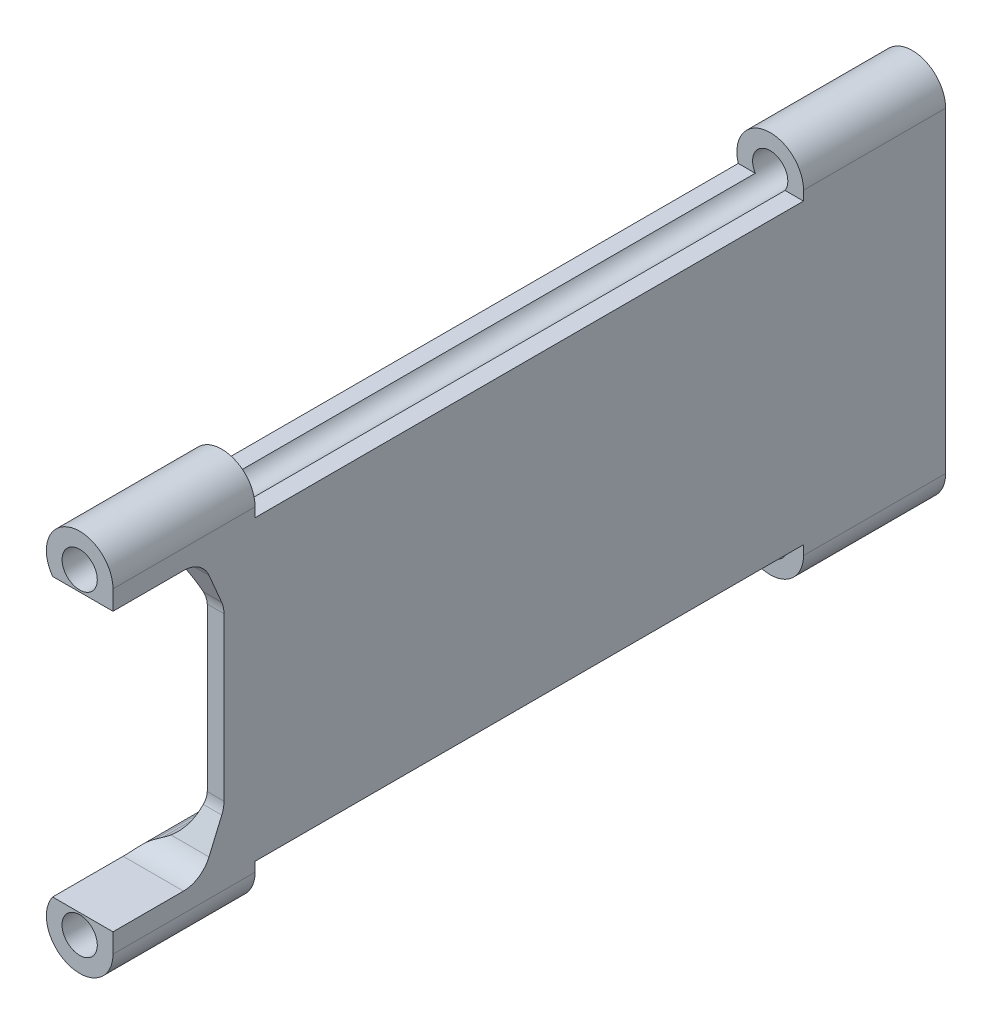
from build123d import *

# Parameters (mm, degrees)
CROQUIS1_R              = 3.175
SALIENTE_EXTRUIR1_DEPTH = 150
REDONDEO1_R             = 10
CORTAR_EXTRUIR1_DEPTH   = 155.383451186
REDONDEO2_R             = 5
CROQUIS3_W              = 98.791812306
CROQUIS3_H              = 18.145434914
CORTAR_EXTRUIR2_DEPTH   = 155.383451313


with BuildPart() as part:
    # Croquis1 → Saliente-Extruir1 (new body)
    with BuildSketch(Plane.XY):
        with BuildLine():
            Line((-3, 19.859827637), (-8.98691391, 23.296314259))
            ThreePointArc((-8.98691391, 23.296314259), (-9.006535925, 33.69237342), (0, 28.5))
            Line((0, 28.5), (0, -28.5))
            ThreePointArc((0, -28.5), (-9.006535925, -33.69237342), (-8.98691391, -23.296314259))
            Line((-8.98691391, -23.296314259), (-3, -19.859827637))
            Line((-3, -19.859827637), (-3, 19.859827637))
        make_face()
        with Locations((-6, 28.5)):
            Circle(CROQUIS1_R, mode=Mode.SUBTRACT)
        with Locations((-6, -28.5)):
            Circle(CROQUIS1_R, mode=Mode.SUBTRACT)
    extrude(amount=-SALIENTE_EXTRUIR1_DEPTH)

    # Redondeo1
    redondeo1_edges = [part.edges().sort_by_distance(p)[0] for p in [
        (-3, -19.859827637, -75),
        (-3, 19.859827637, -75),
    ]]
    fillet(redondeo1_edges, radius=REDONDEO1_R)

    # Croquis2 → Cortar-Extruir1 (cut, through all)
    with BuildSketch(Plane(origin=(0, 0, 0), x_dir=(0, 0, -1), z_dir=(1, 0, 0))):
        Polygon((16, 25), (20, 15.646846929), (20, -15.646846929), (16, -25), (-29.873538988, -25), (-29.873538988, 25), align=None)
    extrude(amount=-CORTAR_EXTRUIR1_DEPTH, mode=Mode.SUBTRACT)

    # Redondeo2
    redondeo2_edges = [part.edges().sort_by_distance(p)[0] for p in [
        (-1.562589533, 15.646846929, -20),
        (-1.562589533, -15.646846929, -20),
        (-5.436698586, -25, -16),
        (-5.436698586, 25, -16),
    ]]
    fillet(redondeo2_edges, radius=REDONDEO2_R)

    # Croquis3 → Cortar-Extruir2 (cut, through all)
    with BuildSketch(Plane(origin=(0, 0, 0), x_dir=(0, 0, -1), z_dir=(1, 0, 0))):
        with Locations((75, 35.875128035)):
            Rectangle(CROQUIS3_W, CROQUIS3_H)
        with Locations((75, -35.875128035)):
            Rectangle(CROQUIS3_W, CROQUIS3_H)
    extrude(amount=-CORTAR_EXTRUIR2_DEPTH, mode=Mode.SUBTRACT)


solid = part.part
